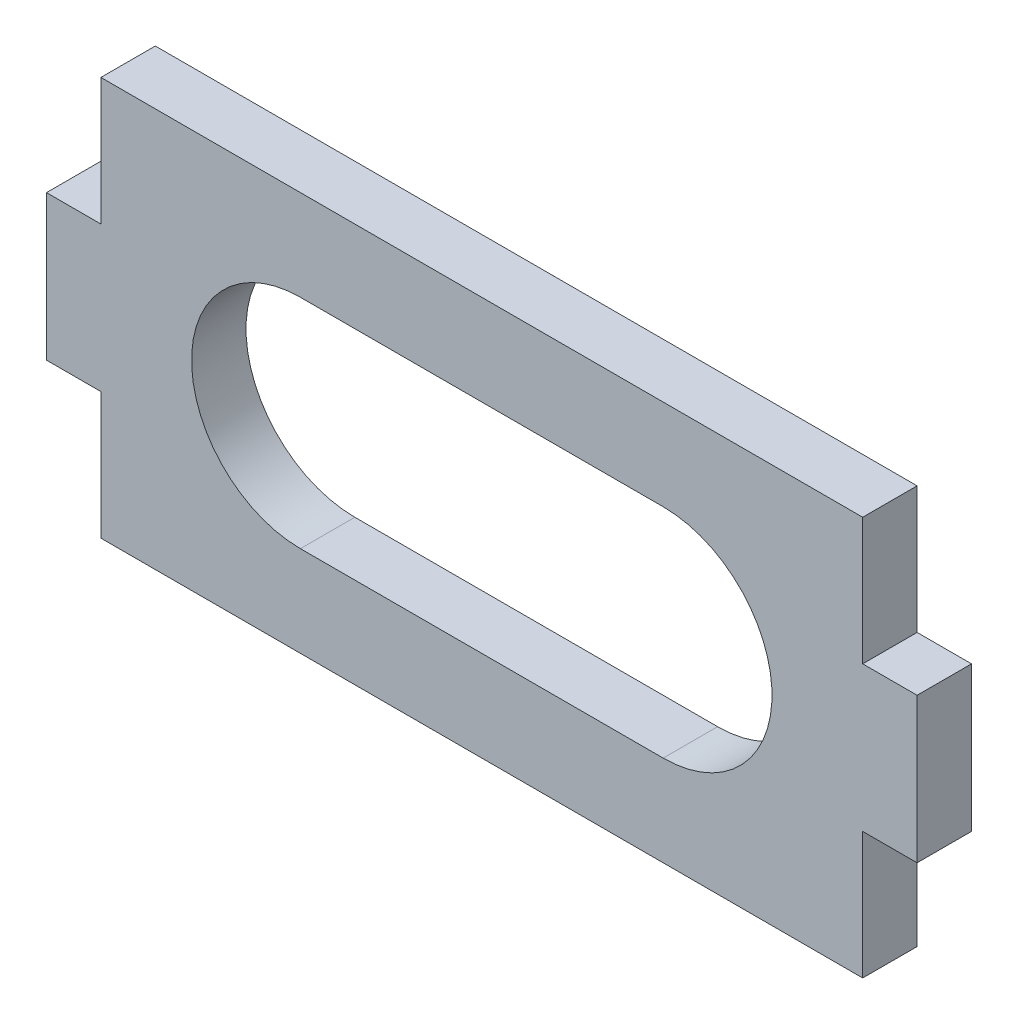
from build123d import *

# Parameters (mm, degrees)
DODANIE_WYCI_GNI_CIE1_DEPTH = 3


with BuildPart() as part:
    # Szkic1 → Dodanie-wyciągnięcie1 (new body)
    with BuildSketch(Plane.XY):
        Polygon((-21, 11), (21, 11), (21, 4), (24, 4), (24, -4), (21, -4), (21, -11), (-21, -11), (-21, -4), (-24, -4), (-24, 4), (-21, 4), align=None)
        with BuildLine():
            Line((-10, 6), (10, 6))
            ThreePointArc((10, 6), (16, 0), (10, -6))
            Line((10, -6), (-10, -6))
            ThreePointArc((-10, -6), (-16, 0), (-10, 6))
        make_face(mode=Mode.SUBTRACT)
    extrude(amount=DODANIE_WYCI_GNI_CIE1_DEPTH)


solid = part.part
